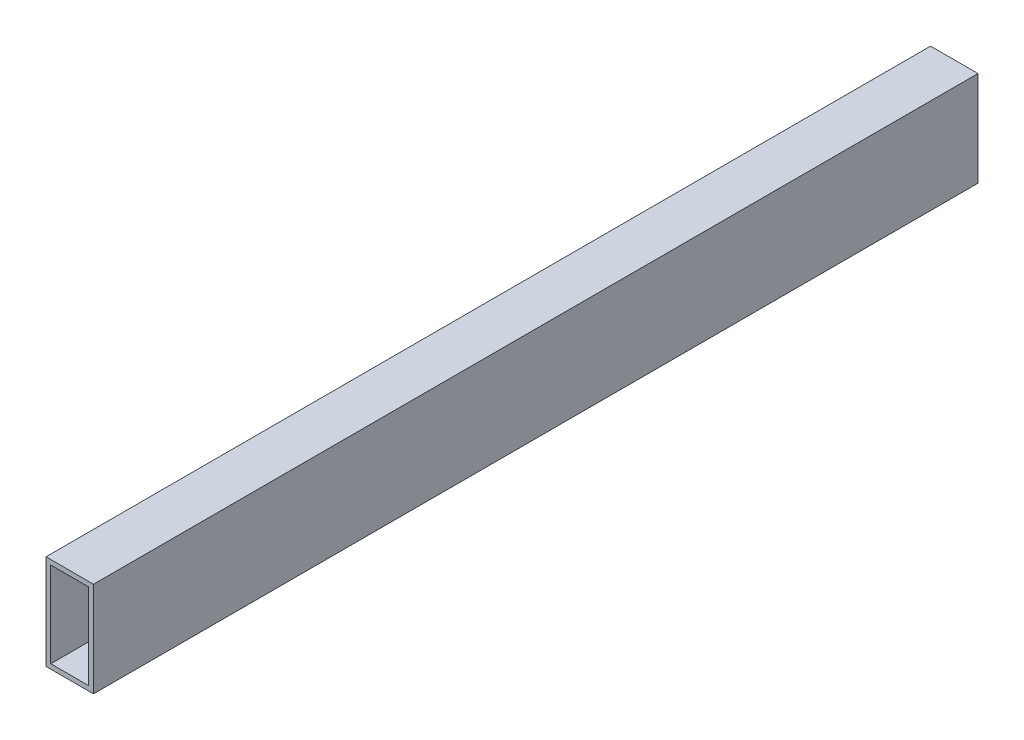
from build123d import *

# Parameters (mm, degrees)
SKETCH1_W           = 25.4
SKETCH1_H           = 50.8
SKETCH1_W_2         = 20.32
SKETCH1_H_2         = 45.72
EXTRUDE_THIN1_DEPTH = 473.075


with BuildPart() as part:
    # Sketch1 → Extrude-Thin1 (new body)
    with BuildSketch(Plane.XY):
        Rectangle(SKETCH1_W, SKETCH1_H)
        Rectangle(SKETCH1_W_2, SKETCH1_H_2, mode=Mode.SUBTRACT)
    extrude(amount=EXTRUDE_THIN1_DEPTH)


solid = part.part
